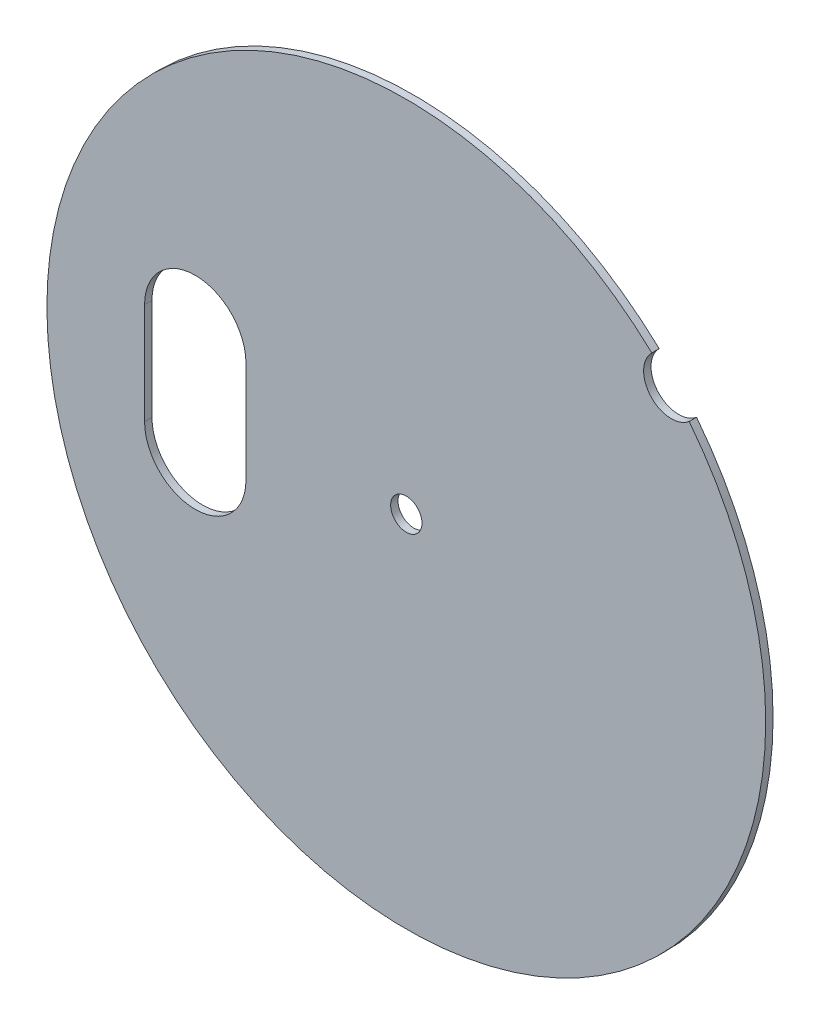
from build123d import *

# Parameters (mm, degrees)
ESQUISSE1_R        = 0.85
BOSS_EXTRU_1_DEPTH = 0.4


with BuildPart() as part:
    # Esquisse1 → Boss.-Extru.1 (new body)
    with BuildSketch(Plane.XY):
        with BuildLine():
            ThreePointArc((13.321737348, 14.240130408), (-14.376908068, -13.174009049), (15.347008325, 12.029934973))
            ThreePointArc((15.347008325, 12.029934973), (13.270992063, 12.160623737), (13.321737348, 14.240130408))
        make_face()
        Circle(ESQUISSE1_R, mode=Mode.SUBTRACT)
        with BuildLine():
            Line((-14.2, -2.75), (-14.2, 2.75))
            ThreePointArc((-14.2, 2.75), (-11.45, 5.5), (-8.7, 2.75))
            Line((-8.7, 2.75), (-8.7, -2.75))
            ThreePointArc((-8.7, -2.75), (-11.45, -5.5), (-14.2, -2.75))
        make_face(mode=Mode.SUBTRACT)
    extrude(amount=BOSS_EXTRU_1_DEPTH)


solid = part.part
